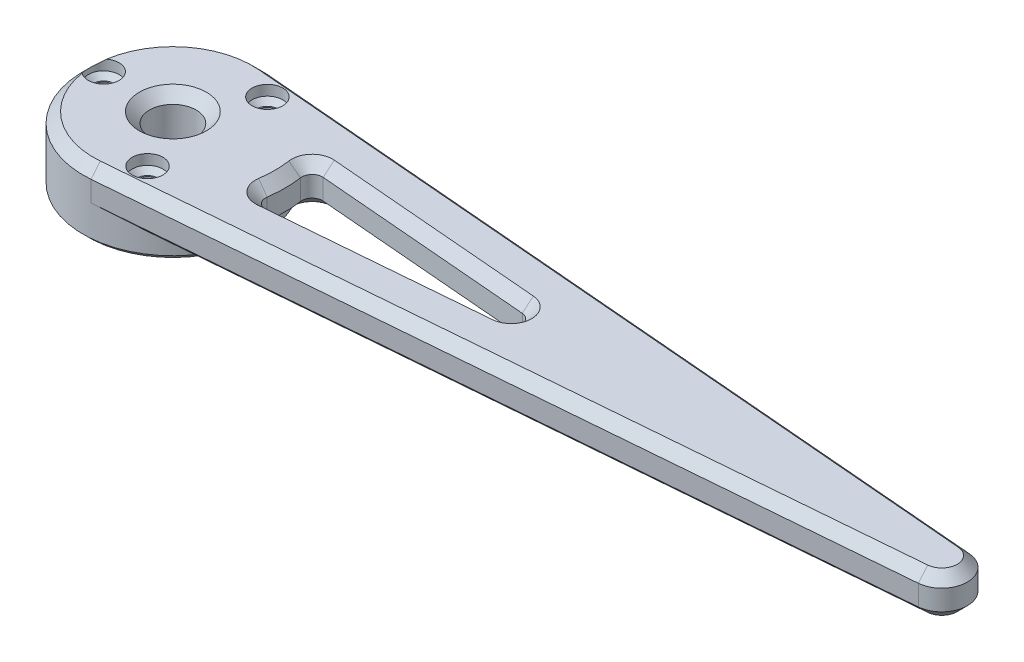
from build123d import *
from build123d.topology import SkipClean

# Parameters (mm, degrees)
SKETCH1_R           = 1.75
BOSS_EXTRUDE1_DEPTH = 8
SKETCH2_R           = 3
CUT_EXTRUDE1_DEPTH  = 3
CUT_EXTRUDE2_DEPTH  = 157.189788399
FILLET1_R           = 2
CHAMFER1_SIZE       = 1
SKETCH4_R           = 4.541609358
CUT_EXTRUDE3_DEPTH  = 157.189788399
BOSS_EXTRUDE2_START = 5
SKETCH5_R           = 17.5
SKETCH5_R_2         = 4.541609358
SKETCH5_R_3         = 1.75
BOSS_EXTRUDE2_DEPTH = 5
CHAMFER2_SIZE       = 2
CHAMFER3_SIZE       = 1


with BuildPart() as part:
    # Sketch1 → Boss-Extrude1 (new body)
    with BuildSketch(Plane(origin=(0, 0, 0), x_dir=(1, 0, 0), z_dir=(0, 1, 0))):
        with BuildLine():
            Line((1.458333333, 17.43913025), (150.416666667, 4.982608643))
            ThreePointArc((150.416666667, 4.982608643), (155, 0), (150.416666667, -4.982608643))
            Line((150.416666667, -4.982608643), (1.458333333, -17.43913025))
            ThreePointArc((1.458333333, -17.43913025), (-17.5, 0), (1.458333333, 17.43913025))
        make_face()
        with Locations(Location((6.75, 11.691342951, 0), (0, 0, 270))):
            Circle(SKETCH1_R, mode=Mode.SUBTRACT)
        with Locations(Location((-13.5, 0, 0), (0, 0, 270))):
            Circle(SKETCH1_R, mode=Mode.SUBTRACT)
        with Locations(Location((6.75, -11.691342951, 0), (0, 0, 270))):
            Circle(SKETCH1_R, mode=Mode.SUBTRACT)
    extrude(amount=BOSS_EXTRUDE1_DEPTH)

    # Sketch2 → Cut-Extrude1 (cut)
    with BuildSketch(Plane(origin=(0, 8, 0), x_dir=(1, 0, 0), z_dir=(0, 1, 0))):
        with Locations(Location((6.75, -11.691342951, 0), (0, 0, 270))):
            Circle(SKETCH2_R)
        with Locations(Location((6.75, 11.691342951, 0), (0, 0, 270))):
            Circle(SKETCH2_R)
        with Locations(Location((-13.5, 0, 0), (0, 0, 270))):
            Circle(SKETCH2_R)
    extrude(amount=-CUT_EXTRUDE1_DEPTH, mode=Mode.SUBTRACT)

    # Sketch3 → Cut-Extrude2 (cut, through all)
    with BuildSketch(Plane(origin=(0, 8, 0), x_dir=(1, 0, 0), z_dir=(0, 1, 0))):
        with BuildLine():
            Line((21.121493084, -5.759910107), (90, 0))
            Line((90, 0), (21.121493084, 5.759910107))
            ThreePointArc((21.121493084, 5.759910107), (21.892784988, 0), (21.121493084, -5.759910107))
        make_face()
    extrude(amount=-CUT_EXTRUDE2_DEPTH, mode=Mode.SUBTRACT)

    # Fillet1
    fillet1_edges = [part.edges().sort_by_distance(p)[0] for p in [
        (21.121493084, 4, 5.759910107),
        (21.121493084, 4, -5.759910107),
        (90, 4, 0),
    ]]
    fillet(fillet1_edges, radius=FILLET1_R)

    # Chamfer1
    chamfer1_edges = [part.edges().sort_by_distance(p)[0] for p in [
        (6.75, 5, 8.691342951),
        (6.75, 5, -14.691342951),
        (-13.5, 5, -3),
    ]]
    chamfer(chamfer1_edges, length=CHAMFER1_SIZE)

    # Sketch4 → Cut-Extrude3 (cut, through all)
    with BuildSketch(Plane(origin=(0, 8, 0), x_dir=(1, 0, 0), z_dir=(0, 1, 0))):
        with Locations(Location((0, 0, 0), (0, 0, 270))):
            Circle(SKETCH4_R)
    extrude(amount=-CUT_EXTRUDE3_DEPTH, mode=Mode.SUBTRACT)

    # Sketch5 → Boss-Extrude2 (add)
    with SkipClean():  # the faces are left unmerged after this step: merging them gives an invalid solid
        with BuildSketch(Plane.XZ.offset(BOSS_EXTRUDE2_START)):
            with Locations(Location((0, 0, 0), (0, 0, 270))):
                Circle(SKETCH5_R)
            with Locations(Location((0, 0, 0), (0, 0, 90))):
                Circle(SKETCH5_R_2, mode=Mode.SUBTRACT)
            with Locations(Location((6.75, 11.691342951, 0), (0, 0, 270))):
                Circle(SKETCH5_R_3, mode=Mode.SUBTRACT)
            with Locations(Location((6.75, -11.691342951, 0), (0, 0, 270))):
                Circle(SKETCH5_R_3, mode=Mode.SUBTRACT)
            with Locations(Location((-13.5, 0, 0), (0, 0, 270))):
                Circle(SKETCH5_R_3, mode=Mode.SUBTRACT)
        extrude(amount=-BOSS_EXTRUDE2_DEPTH)

    # Chamfer2
    # the kernel refuses this chamfer: 2 mm, written as the material it takes off along each edge
    with BuildSketch(Plane(origin=(150, 8, 0), x_dir=(0.0833333333333315, 0, -0.9965217285917835), z_dir=(-0.9965217285917835, 0, -0.0833333333333315))) as chamfer2_piece_1:
        Polygon((5 - CHAMFER2_SIZE, 0), (5, CHAMFER2_SIZE), (5, 0), align=None)
    revolve(axis=Axis((150, 8, 0), (0, -1, 0)), revolution_arc=170.439616306, mode=Mode.SUBTRACT)
    with BuildSketch(Plane(origin=(1.458333333, 8, -17.43913025), x_dir=(-0.08330182640927465, 0.027495876610586497, 0.9961449605786772), z_dir=(0.9965217285917832, 0, 0.08333333333333327)), Plane(origin=(150.416666667, 8, 4.982608643), x_dir=(-0.08330182640927465, 0.027495876610586487, -0.9961449605786772), z_dir=(-0.9965217285917832, 0, 0.08333333333333327))) as chamfer2_piece_2:
        Polygon((CHAMFER2_SIZE * 0.999621916911, CHAMFER2_SIZE * 0.0274958766106), (-CHAMFER2_SIZE * 0.0274958766106, CHAMFER2_SIZE * 0.999621916911), (0, 0), align=None)
    extrude(amount=149.478259289, mode=Mode.SUBTRACT)
    with BuildSketch(Plane(origin=(0, 8, 0), x_dir=(0.08333333333333347, 0, 0.9965217285917832), z_dir=(0.9965217285917832, 0, -0.08333333333333347))) as chamfer2_piece_3:
        Polygon((17.5 - CHAMFER2_SIZE, 0), (17.5, CHAMFER2_SIZE), (17.5, 0), align=None)
    revolve(axis=Axis((0, 8, 0), (0, -1, 0)), revolution_arc=189.560383694, mode=Mode.SUBTRACT)
    with BuildSketch(Plane(origin=(-3.66714262, 0, -17.867744082), x_dir=(0.0022913230508821315, 0.9996219169112968, -0.02740023848912714), z_dir=(0.9965217285917832, 0, 0.08333333333333327))) as chamfer2_piece_4_section:
        Polygon((CHAMFER2_SIZE * 0.999621916911, CHAMFER2_SIZE * 0.0274958766106), (-CHAMFER2_SIZE * 0.0274958766106, CHAMFER2_SIZE * 0.999621916911), (0, 0), align=None)
    chamfer2_piece_4 = extrude(amount=154.621625265, mode=Mode.PRIVATE)
    chamfer2_piece_4 = chamfer2_piece_4 - Plane(origin=(0, 0.665713583, 0), x_dir=(0, 0, -1), z_dir=(0, -1, 0)) * Cylinder(17.5, 318, mode=Mode.PRIVATE)
    add(chamfer2_piece_4, mode=Mode.SUBTRACT)
    with BuildSketch(Plane(origin=(150, 0, 0), x_dir=(0.0833333333333315, 0, -0.9965217285917835), z_dir=(-0.9965217285917835, 0, -0.0833333333333315))) as chamfer2_piece_5:
        Polygon((5, -CHAMFER2_SIZE), (5 - CHAMFER2_SIZE, 0), (5, 0), align=None)
    revolve(axis=Axis((150, 0, 0), (0, -1, 0)), revolution_arc=170.439616306, mode=Mode.SUBTRACT)
    with BuildSketch(Plane(origin=(66.166666667, 8, -1.993043457), x_dir=(0.08330182640927462, 0.02749587661058648, -0.9961449605786772), z_dir=(-0.9965217285917832, 0, -0.08333333333333323)), Plane(origin=(23.795259007, 8, 5.536318568), x_dir=(0.08330182640927467, 0.027495876610586473, 0.9961449605786772), z_dir=(0.9965217285917832, 0, -0.08333333333333327))) as chamfer2_piece_6:
        Polygon((CHAMFER2_SIZE * 0.999621916911, CHAMFER2_SIZE * 0.0274958766106), (-CHAMFER2_SIZE * 0.0274958766106, CHAMFER2_SIZE * 0.999621916911), (0, 0), align=None)
    extrude(amount=42.51930133, mode=Mode.SUBTRACT)
    with BuildSketch(Plane(origin=(23.795259007, 0, -5.536318568), x_dir=(-0.002291323050882199, 0.9996219169112968, 0.027400238489127964), z_dir=(0.9965217285917832, 0, 0.08333333333333323)), Plane(origin=(66.166666667, 0, 1.993043457), x_dir=(-0.002291323050882194, 0.9996219169112968, -0.027400238489127888), z_dir=(-0.9965217285917832, 0, 0.08333333333333327))) as chamfer2_piece_7:
        Polygon((CHAMFER2_SIZE * 0.999621916911, -CHAMFER2_SIZE * 0.0274958766106), (-CHAMFER2_SIZE * 0.0274958766106, -CHAMFER2_SIZE * 0.999621916911), (0, 0), align=None)
    extrude(amount=42.51930133, mode=Mode.SUBTRACT)
    with BuildSketch(Plane(origin=(150.416666667, 0, 4.982608643), x_dir=(0.002291323050882236, 0.9996219169112968, 0.027400238489128394), z_dir=(-0.9965217285917832, 0, 0.08333333333333327))) as chamfer2_piece_8_section:
        Polygon((CHAMFER2_SIZE * 0.999621916911, CHAMFER2_SIZE * 0.0274958766106), (-CHAMFER2_SIZE * 0.0274958766106, CHAMFER2_SIZE * 0.999621916911), (0, 0), align=None)
    chamfer2_piece_8 = extrude(amount=154.621625265, mode=Mode.PRIVATE)
    chamfer2_piece_8 = chamfer2_piece_8 - Plane(origin=(0, 0.665713582, 0), x_dir=(0, 0, -1), z_dir=(0, -1, 0)) * Cylinder(17.5, 318, mode=Mode.PRIVATE)
    add(chamfer2_piece_8, mode=Mode.SUBTRACT)
    with BuildSketch(Plane(origin=(0, 8, 0), x_dir=(0.9889425762591825, 0, -0.14829895772341384), z_dir=(-0.14829895772341384, 0, -0.9889425762591825))) as chamfer2_piece_9:
        Polygon((21.892784988 - CHAMFER2_SIZE, 0), (21.892784988, CHAMFER2_SIZE), (21.892784988, 0), align=None)
    revolve(axis=Axis((0, 8, 0), (0, -1, 0)), revolution_arc=17.056723038, mode=Mode.SUBTRACT)
    with BuildSketch(Plane(origin=(0, 0, 0), x_dir=(0.9889425762591825, 0, 0.14829895772341486), z_dir=(-0.14829895772341486, 0, 0.9889425762591825))) as chamfer2_piece_10:
        Polygon((21.892784988, CHAMFER2_SIZE), (21.892784988 - CHAMFER2_SIZE, 0), (21.892784988, 0), align=None)
    revolve(axis=Axis((0, 0, 0), (0, 1, 0)), revolution_arc=17.056723038, mode=Mode.SUBTRACT)
    with BuildSketch(Plane(origin=(66, 8, 0), x_dir=(0.0833333333333357, 0, 0.996521728591783), z_dir=(-0.996521728591783, 0, 0.0833333333333357))) as chamfer2_piece_11:
        Polygon((2 + CHAMFER2_SIZE, 0), (2, -CHAMFER2_SIZE), (2, 0), align=None)
    revolve(axis=Axis((66, 8, 0), (0, 1, 0)), revolution_arc=170.439616306, mode=Mode.SUBTRACT)
    with BuildSketch(Plane(origin=(66, 0, 0), x_dir=(0.0833333333333357, 0, 0.996521728591783), z_dir=(-0.996521728591783, 0, 0.0833333333333357))) as chamfer2_piece_12:
        Polygon((2, CHAMFER2_SIZE), (2 + CHAMFER2_SIZE, 0), (2, 0), align=None)
    revolve(axis=Axis((66, 0, 0), (0, 1, 0)), revolution_arc=170.439616306, mode=Mode.SUBTRACT)
    with BuildSketch(Plane(origin=(23.62859234, 8, 3.543275111), x_dir=(0.08333333333333393, 0, 0.9965217285917831), z_dir=(0.9965217285917831, 0, -0.08333333333333393))) as chamfer2_piece_13:
        Polygon((2 + CHAMFER2_SIZE, 0), (2, CHAMFER2_SIZE), (2, 0), align=None)
    revolve(axis=Axis((23.62859234, 8, 3.543275111), (0, -1, 0)), revolution_arc=103.308553366, mode=Mode.SUBTRACT)
    with BuildSketch(Plane(origin=(23.62859234, 0, 3.543275111), x_dir=(0.08333333333333393, 0, 0.9965217285917831), z_dir=(0.9965217285917831, 0, -0.08333333333333393))) as chamfer2_piece_14:
        Polygon((2, -CHAMFER2_SIZE), (2 + CHAMFER2_SIZE, 0), (2, 0), align=None)
    revolve(axis=Axis((23.62859234, 0, 3.543275111), (0, -1, 0)), revolution_arc=103.308553366, mode=Mode.SUBTRACT)
    with BuildSketch(Plane(origin=(23.62859234, 8, -3.543275111), x_dir=(-0.9889425762591827, 0, 0.14829895772341356), z_dir=(0.14829895772341356, 0, 0.9889425762591827))) as chamfer2_piece_15:
        Polygon((2 + CHAMFER2_SIZE, 0), (2, CHAMFER2_SIZE), (2, 0), align=None)
    revolve(axis=Axis((23.62859234, 8, -3.543275111), (0, -1, 0)), revolution_arc=103.308553366, mode=Mode.SUBTRACT)
    with BuildSketch(Plane(origin=(23.62859234, 0, -3.543275111), x_dir=(-0.9889425762591827, 0, 0.14829895772341356), z_dir=(0.14829895772341356, 0, 0.9889425762591827))) as chamfer2_piece_16:
        Polygon((2, -CHAMFER2_SIZE), (2 + CHAMFER2_SIZE, 0), (2, 0), align=None)
    revolve(axis=Axis((23.62859234, 0, -3.543275111), (0, -1, 0)), revolution_arc=103.308553366, mode=Mode.SUBTRACT)
    with BuildSketch(Plane(origin=(0, 8, 0), x_dir=(0, 0, 1), z_dir=(-1, 0, 0))) as chamfer2_piece_17:
        Polygon((4.541609358 + CHAMFER2_SIZE, 0), (4.541609358, -CHAMFER2_SIZE), (4.541609358, 0), align=None)
    revolve(axis=Axis((0, 8, 0), (0, 1, 0)), mode=Mode.SUBTRACT)

    # Chamfer3
    chamfer3_edges = [part.edges().sort_by_distance(p)[0] for p in [
        (0, -5, 17.5),
    ]]
    chamfer(chamfer3_edges, length=CHAMFER3_SIZE)


solid = part.part
